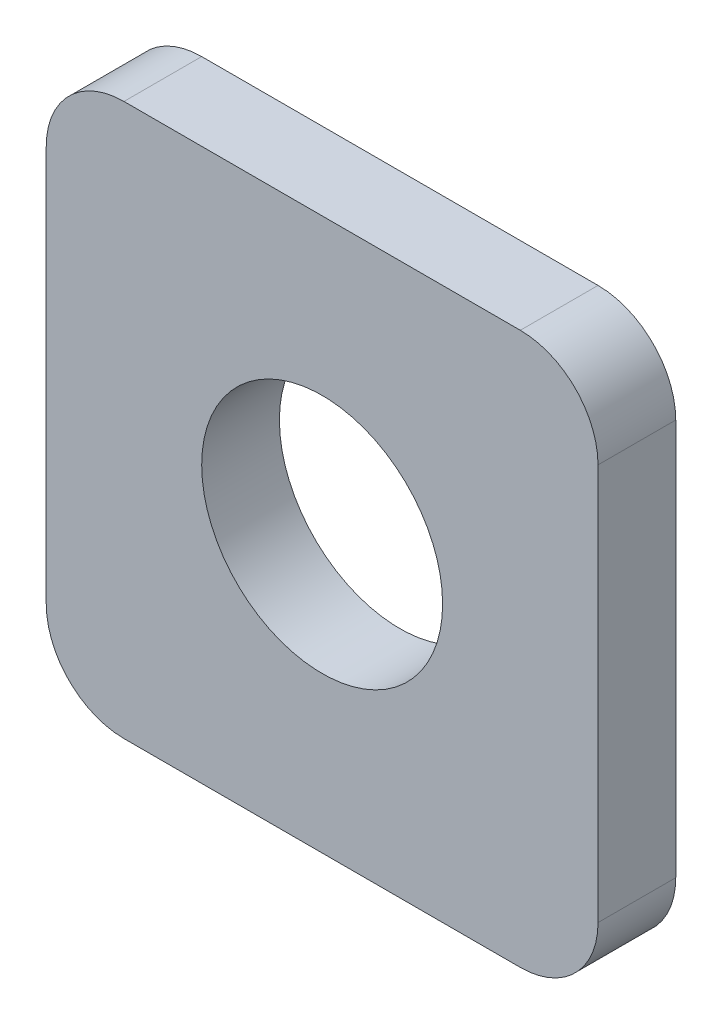
from build123d import *

# Parameters (mm, degrees)
IZIM1_W            = 71
IZIM1_H            = 71
IZIM1_R            = 15.5
TABAN_FLAN_1_DEPTH = 10
RADYUS1_R          = 10


# Sheet-metal steps are written as plain solids
with BuildPart() as part:
    # Çizim1 → Taban-Flanş1 (new body)
    with BuildSketch(Plane.XY):
        Rectangle(IZIM1_W, IZIM1_H)
        Circle(IZIM1_R, mode=Mode.SUBTRACT)
    extrude(amount=-TABAN_FLAN_1_DEPTH)

    # Radyus1
    radyus1_edges = [part.edges().sort_by_distance(p)[0] for p in [
        (35.5, -35.5, -5),
        (-35.5, -35.5, -5),
        (-35.5, 35.5, -5),
        (35.5, 35.5, -5),
    ]]
    fillet(radyus1_edges, radius=RADYUS1_R)


solid = part.part
